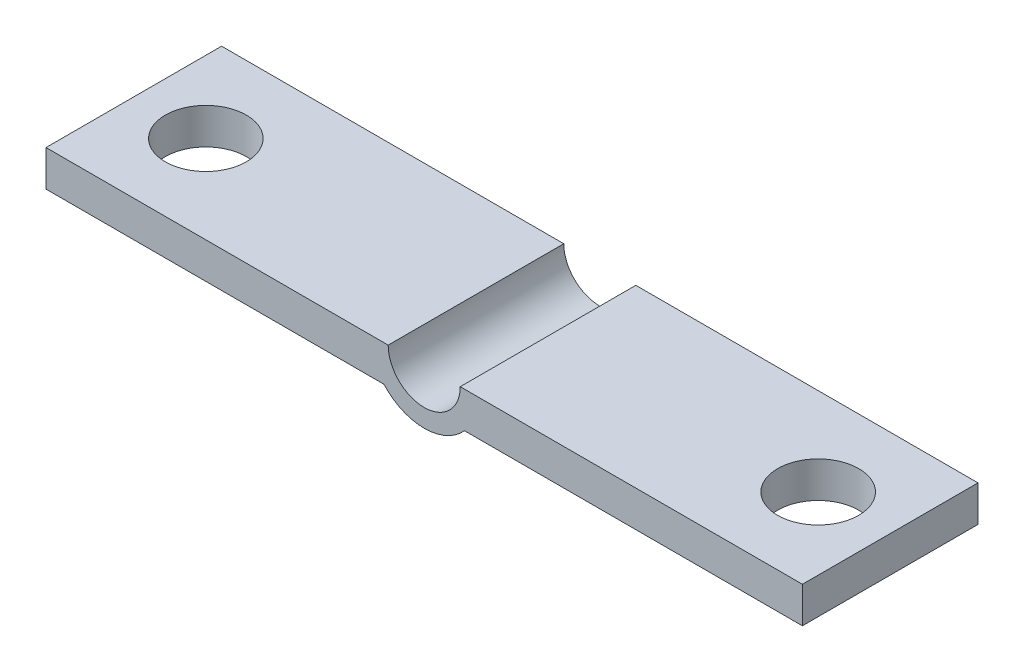
from build123d import *

# Parameters (mm, degrees)
EXTRUDE_THIN1_DEPTH = 9.75
SKETCH3_W           = 19
SKETCH3_H           = 9.75
BOSS_EXTRUDE1_DEPTH = 2
SKETCH4_R           = 2.25
CUT_EXTRUDE1_DEPTH  = 24.346573624


with BuildPart() as part:
    # Sketch1 → Extrude-Thin1 (new body)
    with BuildSketch(Plane.XY):
        with BuildLine():
            ThreePointArc((-2, 0), (0, -2), (2, 0))
            Line((2, 0), (3, 0))
            ThreePointArc((3, 0), (0, -3), (-3, 0))
            Line((-3, 0), (-2, 0))
        make_face()
    extrude(amount=EXTRUDE_THIN1_DEPTH)

    # Sketch3 → Boss-Extrude1 (add)
    with BuildSketch(Plane(origin=(0, 0, 0), x_dir=(1, 0, 0), z_dir=(0, 1, 0))):
        with Locations((-11.5, -4.875)):
            Rectangle(SKETCH3_W, SKETCH3_H)
        with Locations((11.5, -4.875)):
            Rectangle(SKETCH3_W, SKETCH3_H)
    extrude(amount=-BOSS_EXTRUDE1_DEPTH)

    # Sketch4 → Cut-Extrude1 (cut, through all)
    with BuildSketch(Plane(origin=(0, 0, 0), x_dir=(1, 0, 0), z_dir=(0, 1, 0))):
        with Locations((-17, -4.875)):
            Circle(SKETCH4_R)
        with Locations((17, -4.875)):
            Circle(SKETCH4_R)
    extrude(amount=-CUT_EXTRUDE1_DEPTH, mode=Mode.SUBTRACT)


solid = part.part
